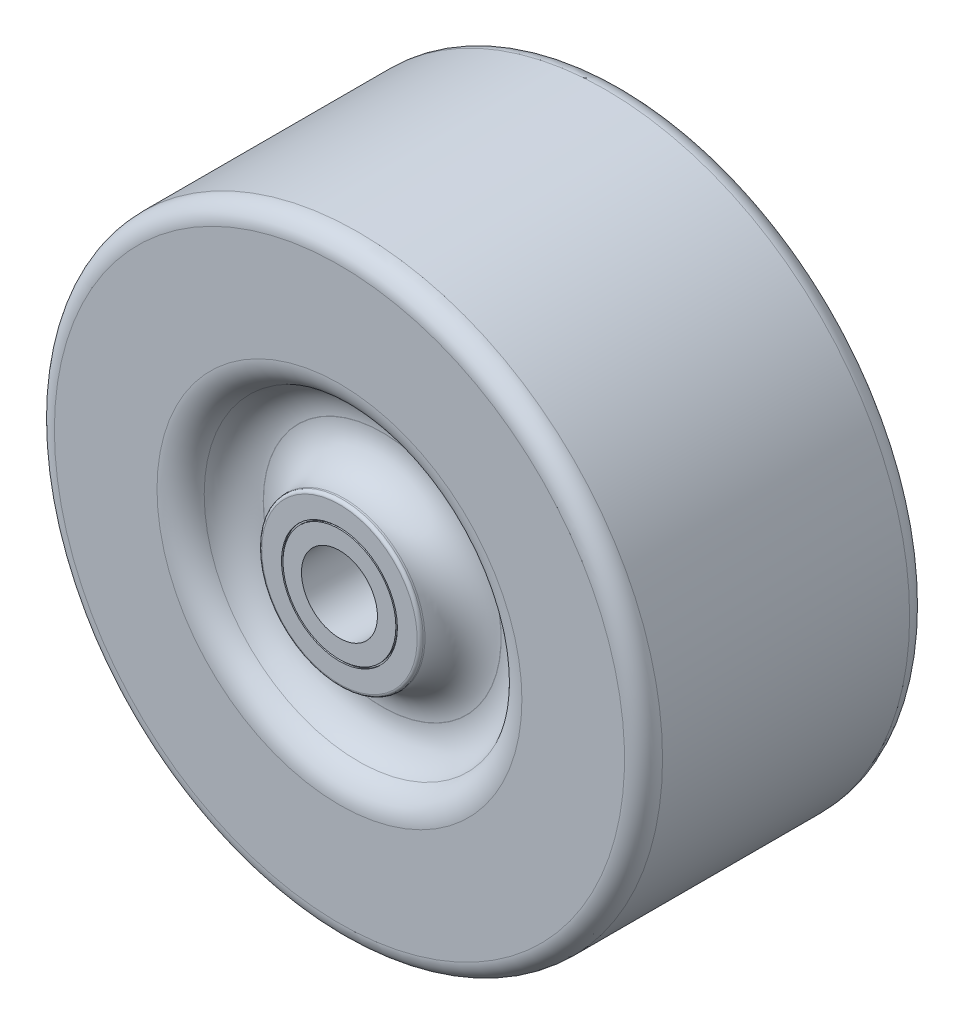
from build123d import *

# Parameters (mm, degrees)
REVOLVE1_ANGLE    = 90
FILLET3_R         = 2.54
FILLET4_R         = 0.254
CIRPATTERN2_COUNT = 4
FILLET1_R         = 3.175
FILLET2_R         = 1.5875


with BuildPart() as part:
    # Sketch2 → Revolve1 (revolve)
    with BuildSketch(Plane(origin=(0, 0, 0), x_dir=(0, 0, -1), z_dir=(1, 0, 0))):
        Polygon((-11.90625, 3.175), (0, 3.175), (0, 25.4), (-11.90625, 25.4), (-11.90625, 12.7), (-8.334375, 12.7), (-8.334375, 6.746875), (-11.90625, 6.746875), (-11.90625, 4.841875), (-11.77925, 4.841875), (-11.77925, 4.714875), (-11.90625, 4.714875), align=None)
    revolve(axis=Axis((0, 0, 16.118337808), (0, 0, -1)), revolution_arc=REVOLVE1_ANGLE)

    # Fillet3
    fillet3_edges = [part.edges().sort_by_distance(p)[0] for p in [
        (8.980256121, 8.980256121, 11.90625),
    ]]
    fillet(fillet3_edges, radius=FILLET3_R)

    # Fillet4
    fillet4_edges = [part.edges().sort_by_distance(p)[0] for p in [
        (4.770761064, 4.770761064, 11.90625),
    ]]
    fillet(fillet4_edges, radius=FILLET4_R)

    # Mirror1: part across plane


with BuildPart() as part_1:
    add(part.part)
    add(part.part.mirror(Plane.XY))


with BuildPart() as cirpattern2_1:
    # CirPattern2: pattern copy
    add(part_1.part.rotate(Axis((0, 0, 16.118337808), (0, 0, 1)), 1 * 360 / CIRPATTERN2_COUNT))


with BuildPart() as cirpattern2_2:
    # CirPattern2: pattern copy
    add(part_1.part.rotate(Axis((0, 0, 16.118337808), (0, 0, 1)), 2 * 360 / CIRPATTERN2_COUNT))


with BuildPart() as cirpattern2_3:
    # CirPattern2: pattern copy
    add(part_1.part.rotate(Axis((0, 0, 16.118337808), (0, 0, 1)), 3 * 360 / CIRPATTERN2_COUNT))

    # Combine1: read off the stored shape, not the designer's step
    # Combine1: union CirPattern2_2, CirPattern2_1, part
    add(cirpattern2_2.part)
    add(cirpattern2_1.part)
    add(part_1.part)

    # Fillet1
    fillet1_edges = [cirpattern2_3.edges().sort_by_distance(p)[0] for p in [
        (-6.746875, 0, 8.334375),
        (-12.7, 0, 8.334375),
        (-12.7, 0, 9.36625),
        (-12.7, 0, -8.334375),
        (-6.746875, 0, -8.334375),
        (-12.7, 0, -9.36625),
    ]]
    fillet(fillet1_edges, radius=FILLET1_R)

    # Fillet2
    fillet2_edges = [cirpattern2_3.edges().sort_by_distance(p)[0] for p in [
        (-25.4, 0, 11.90625),
        (-25.4, 0, -11.90625),
    ]]
    fillet(fillet2_edges, radius=FILLET2_R)


solid = cirpattern2_3.part
